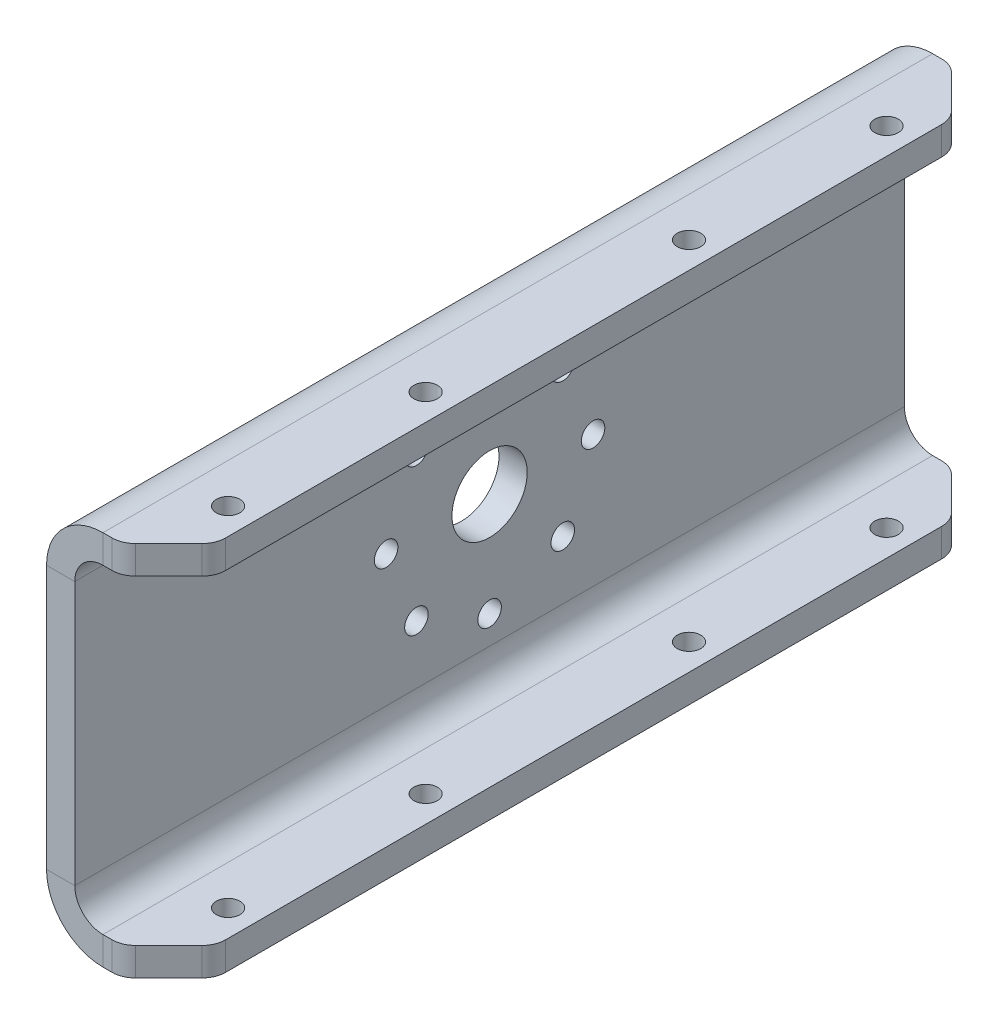
from build123d import *

# Parameters (mm, degrees)
BASE_FLANGE1_DEPTH = 88.2
CHAMFER1_SIZE      = 5
FILLET1_R          = 2.5
SKETCH4_R          = 4
CUT_EXTRUDE1_DEPTH = 92.368703613
SKETCH5_R          = 1.25
CUT_EXTRUDE2_DEPTH = 92.368703613
SKETCH6_R          = 1.25
CUT_EXTRUDE3_DEPTH = 98.361388651


# Sheet-metal steps are written as plain solids
with BuildPart() as part:
    # Sketch1 → Base-Flange1 (new body)
    with BuildSketch(Plane.XY):
        with BuildLine():
            Line((10, -17), (3, -17))
            ThreePointArc((3, -17), (0.878679656, -16.121320344), (0, -14))
            Line((0, -14), (0, 0))
            Line((0, 0), (0, 14))
            ThreePointArc((0, 14), (0.878679656, 16.121320344), (3, 17))
            Line((3, 17), (10, 17))
            Line((10, 17), (10, 20))
            Line((10, 20), (3, 20))
            ThreePointArc((3, 20), (-1.242640687, 18.242640687), (-3, 14))
            Line((-3, 14), (-3, 0))
            Line((-3, 0), (-3, -14))
            ThreePointArc((-3, -14), (-1.242640687, -18.242640687), (3, -20))
            Line((3, -20), (10, -20))
            Line((10, -20), (10, -17))
        make_face()
    extrude(amount=BASE_FLANGE1_DEPTH)

    # Chamfer1
    chamfer1_edges = [part.edges().sort_by_distance(p)[0] for p in [
        (10, 18.5, 0),
        (10, -18.5, 0),
        (10, 18.5, 88.2),
        (10, -18.5, 88.2),
    ]]
    chamfer(chamfer1_edges, length=CHAMFER1_SIZE)

    # Fillet1
    fillet1_edges = [part.edges().sort_by_distance(p)[0] for p in [
        (5, -18.5, 0),
        (10, -18.5, 83.2),
        (10, -18.5, 5),
        (5, 18.5, 0),
        (10, 18.5, 83.2),
        (10, 18.5, 5),
        (5, -18.5, 88.2),
        (5, 18.5, 88.2),
    ]]
    fillet(fillet1_edges, radius=FILLET1_R)

    # Sketch4 → Cut-Extrude1 (cut, through all)
    with BuildSketch(Plane.ZY.offset(3)):
        with Locations(Location((44.1, 0, 0), (0, 0, 270))):
            Circle(SKETCH4_R)
    extrude(amount=-CUT_EXTRUDE1_DEPTH, mode=Mode.SUBTRACT)

    # Sketch5 → Cut-Extrude2 (cut, through all)
    with BuildSketch(Plane.ZY.offset(3)):
        with Locations(Location((44.1, 11, 0), (0, 0, 270))):
            Circle(SKETCH5_R)
        with Locations(Location((51.878174593, 7.778174593, 0), (0, 0, 270))):
            Circle(SKETCH5_R)
        with Locations(Location((55.1, 0, 0), (0, 0, 270))):
            Circle(SKETCH5_R)
        with Locations(Location((51.878174593, -7.778174593, 0), (0, 0, 270))):
            Circle(SKETCH5_R)
        with Locations(Location((44.1, -11, 0), (0, 0, 270))):
            Circle(SKETCH5_R)
        with Locations(Location((36.321825407, -7.778174593, 0), (0, 0, 270))):
            Circle(SKETCH5_R)
        with Locations(Location((33.1, 0, 0), (0, 0, 270))):
            Circle(SKETCH5_R)
        with Locations(Location((36.321825407, 7.778174593, 0), (0, 0, 270))):
            Circle(SKETCH5_R)
    extrude(amount=-CUT_EXTRUDE2_DEPTH, mode=Mode.SUBTRACT)

    # Sketch6 → Cut-Extrude3 (cut, through all)
    with BuildSketch(Plane(origin=(0, 20, 0), x_dir=(1, 0, 0), z_dir=(0, 1, 0))):
        with Locations(Location((7.2, -79.1, 0), (0, 0, 270))):
            Circle(SKETCH6_R)
        with Locations(Location((7.2, -58.1, 0), (0, 0, 270))):
            Circle(SKETCH6_R)
        with Locations(Location((7.2, -30.1, 0), (0, 0, 90))):
            Circle(SKETCH6_R)
        with Locations(Location((7.2, -9.1, 0), (0, 0, 90))):
            Circle(SKETCH6_R)
    extrude(amount=-CUT_EXTRUDE3_DEPTH, mode=Mode.SUBTRACT)


solid = part.part
